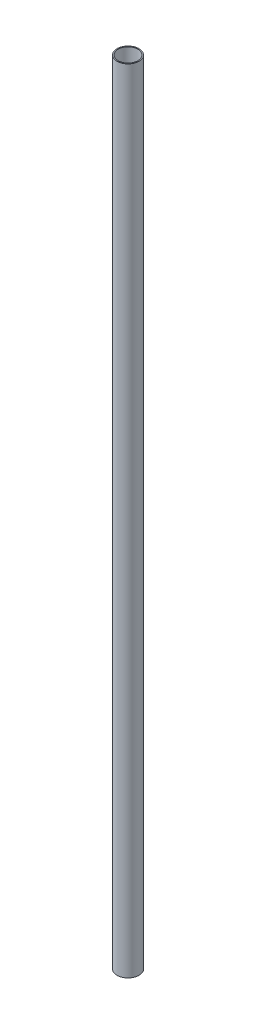
from build123d import *

# Parameters (mm, degrees)
SKETCH1_R           = 12.7
SKETCH1_R_2         = 11.5
BOSS_EXTRUDE1_DEPTH = 915


with BuildPart() as part:
    # Sketch1 → Boss-Extrude1 (new body)
    with BuildSketch(Plane(origin=(0, 0, 0), x_dir=(1, 0, 0), z_dir=(0, 1, 0))):
        Circle(SKETCH1_R)
        Circle(SKETCH1_R_2, mode=Mode.SUBTRACT)
    extrude(amount=BOSS_EXTRUDE1_DEPTH)


solid = part.part
